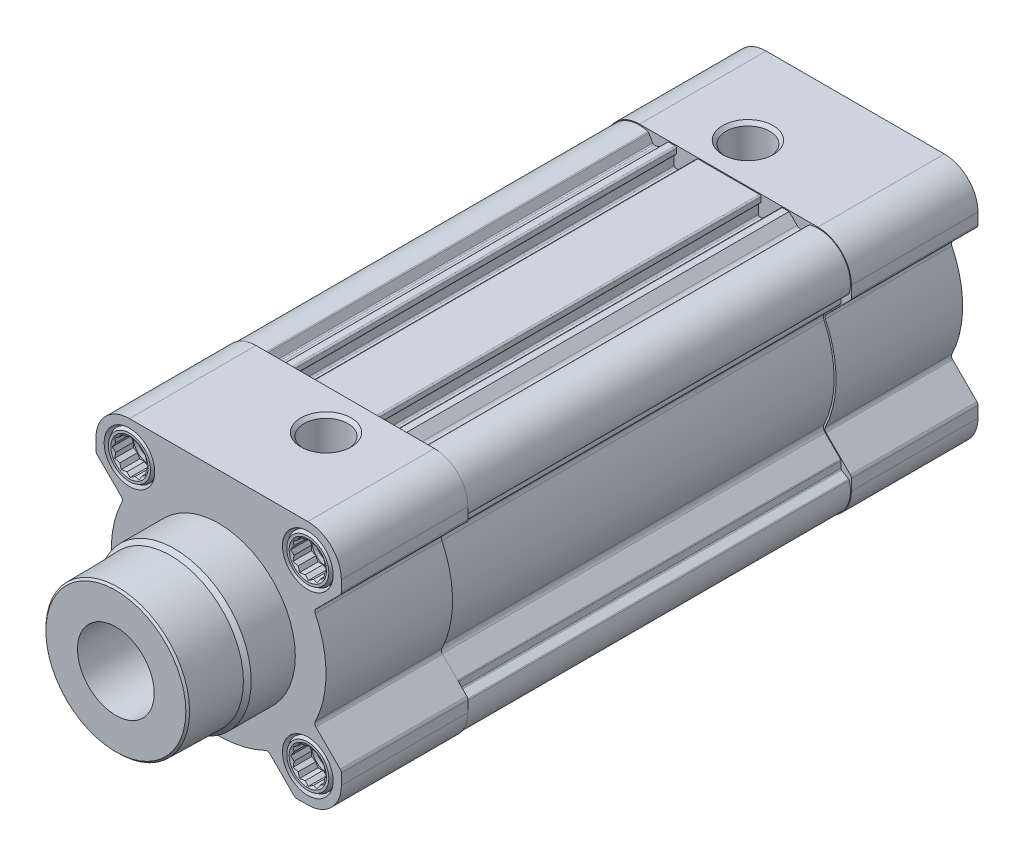
from build123d import *

# Parameters (mm, degrees)
BOSS_EXTRUDE1_DEPTH  = 33
BOSS_EXTRUDE2_DEPTH  = 100
SKETCH3_W            = 76.8
SKETCH3_H            = 76.8
CUT_EXTRUDE1_DEPTH   = 100
BOSS_EXTRUDE3_DEPTH  = 33
HOLE1_D              = 11.445
HOLE1_DEPTH          = 32
HOLE1_CSINK_D        = 13.157
HOLE1_CSINK_ANGLE    = 90
SKETCH8_W            = 24.5
SKETCH8_H            = 6.6
LPATTERN1_COUNT      = 2
LPATTERN1_PITCH      = 46.5
LPATTERN1_COUNT_DIR2 = 2
LPATTERN1_PITCH_DIR2 = 46.5
LPATTERN2_COUNT      = 2
LPATTERN2_PITCH      = 46.5
LPATTERN2_COUNT_DIR2 = 2
LPATTERN2_PITCH_DIR2 = 46.5
CUT_EXTRUDE2_DEPTH   = 5
LPATTERN3_COUNT      = 2
LPATTERN3_PITCH      = 46.5
LPATTERN3_COUNT_DIR2 = 2
LPATTERN3_PITCH_DIR2 = 46.5
LPATTERN4_COUNT      = 2
LPATTERN4_PITCH      = 46.5
LPATTERN4_COUNT_DIR2 = 2
LPATTERN4_PITCH_DIR2 = 46.5
HOLE2_D              = 11.445
HOLE2_DEPTH          = 32
HOLE2_CSINK_D        = 13.157
HOLE2_CSINK_ANGLE    = 90
HOLE3_D              = 13.2
HOLE3_DEPTH          = 24.5
LPATTERN5_COUNT      = 2
LPATTERN5_PITCH      = 46.5
LPATTERN5_COUNT_DIR2 = 2
LPATTERN5_PITCH_DIR2 = 46.5
LPATTERN6_COUNT      = 2
LPATTERN6_PITCH      = 46.5
LPATTERN6_COUNT_DIR2 = 2
LPATTERN6_PITCH_DIR2 = 46.5
LPATTERN7_COUNT      = 2
LPATTERN7_PITCH      = 46.5
LPATTERN7_COUNT_DIR2 = 2
LPATTERN7_PITCH_DIR2 = 46.5
CUT_EXTRUDE3_DEPTH   = 5
LPATTERN8_COUNT      = 2
LPATTERN8_PITCH      = 46.5
LPATTERN8_COUNT_DIR2 = 2
LPATTERN8_PITCH_DIR2 = 46.5


with BuildPart() as part:
    # Sketch1 → Boss-Extrude1 (new body)
    with BuildSketch(Plane.XY.offset(-33)):
        with BuildLine():
            Line((-31.707106781, 19.686291501), (-25.38500441, 13.36418913))
            ThreePointArc((-25.38500441, 13.36418913), (-25.10600235, 12.82318278), (-25.192383219, 12.220631233))
            ThreePointArc((-25.192383219, 12.220631233), (-28, 0), (-25.192383219, -12.220631233))
            ThreePointArc((-25.192383219, -12.220631233), (-25.10600235, -12.82318278), (-25.38500441, -13.36418913))
            Line((-25.38500441, -13.36418913), (-31.707106781, -19.686291501))
            ThreePointArc((-31.707106781, -19.686291501), (-31.923879533, -20.01071485), (-32, -20.393398282))
            Line((-32, -20.393398282), (-32, -23.25))
            ThreePointArc((-32, -23.25), (-29.437184335, -29.437184335), (-23.25, -32))
            Line((-23.25, -32), (-20.393398282, -32))
            ThreePointArc((-20.393398282, -32), (-20.01071485, -31.923879533), (-19.686291501, -31.707106781))
            Line((-19.686291501, -31.707106781), (-13.36418913, -25.38500441))
            ThreePointArc((-13.36418913, -25.38500441), (-12.82318278, -25.10600235), (-12.220631233, -25.192383219))
            ThreePointArc((-12.220631233, -25.192383219), (0, -28), (12.220631233, -25.192383219))
            ThreePointArc((12.220631233, -25.192383219), (12.82318278, -25.10600235), (13.36418913, -25.38500441))
            Line((13.36418913, -25.38500441), (19.686291501, -31.707106781))
            ThreePointArc((19.686291501, -31.707106781), (20.01071485, -31.923879533), (20.393398282, -32))
            Line((20.393398282, -32), (23.25, -32))
            ThreePointArc((23.25, -32), (29.437184335, -29.437184335), (32, -23.25))
            Line((32, -23.25), (32, -20.393398282))
            ThreePointArc((32, -20.393398282), (31.923879533, -20.01071485), (31.707106781, -19.686291501))
            Line((31.707106781, -19.686291501), (25.38500441, -13.36418913))
            ThreePointArc((25.38500441, -13.36418913), (25.10600235, -12.82318278), (25.192383219, -12.220631233))
            ThreePointArc((25.192383219, -12.220631233), (28, 0), (25.192383219, 12.220631233))
            ThreePointArc((25.192383219, 12.220631233), (25.10600235, 12.82318278), (25.38500441, 13.36418913))
            Line((25.38500441, 13.36418913), (31.707106781, 19.686291501))
            ThreePointArc((31.707106781, 19.686291501), (31.923879533, 20.01071485), (32, 20.393398282))
            Line((32, 20.393398282), (32, 23.25))
            ThreePointArc((32, 23.25), (29.437184335, 29.437184335), (23.25, 32))
            Line((23.25, 32), (-23.25, 32))
            ThreePointArc((-23.25, 32), (-29.437184335, 29.437184335), (-32, 23.25))
            Line((-32, 23.25), (-32, 20.393398282))
            ThreePointArc((-32, 20.393398282), (-31.923879533, 20.01071485), (-31.707106781, 19.686291501))
        make_face()
    extrude(amount=BOSS_EXTRUDE1_DEPTH)

    # Sketch2 → Boss-Extrude2 (add)
    with BuildSketch(Plane.XY.offset(-33)):
        with BuildLine():
            Line((-31.75, 20.08273811), (-25.296126931, 13.628865041))
            ThreePointArc((-25.296126931, 13.628865041), (-24.87846612, 12.822305384), (-25.00284256, 11.922577907))
            ThreePointArc((-25.00284256, 11.922577907), (-27.7, 0), (-25.00284256, -11.922577907))
            ThreePointArc((-25.00284256, -11.922577907), (-24.87846612, -12.822305384), (-25.296126931, -13.628865041))
            Line((-25.296126931, -13.628865041), (-31.75, -20.08273811))
            Line((-31.75, -20.08273811), (-31.75, -23.5))
            ThreePointArc((-31.75, -23.5), (-29.333630945, -29.333630945), (-23.5, -31.75))
            Line((-23.5, -31.75), (-20.08273811, -31.75))
            Line((-20.08273811, -31.75), (-13.628865041, -25.296126931))
            ThreePointArc((-13.628865041, -25.296126931), (-12.822305384, -24.87846612), (-11.922577907, -25.00284256))
            ThreePointArc((-11.922577907, -25.00284256), (0, -27.7), (11.922577907, -25.00284256))
            ThreePointArc((11.922577907, -25.00284256), (12.822305384, -24.87846612), (13.628865041, -25.296126931))
            Line((13.628865041, -25.296126931), (20.08273811, -31.75))
            Line((20.08273811, -31.75), (23.5, -31.75))
            ThreePointArc((23.5, -31.75), (29.333630945, -29.333630945), (31.75, -23.5))
            Line((31.75, -23.5), (31.75, -20.08273811))
            Line((31.75, -20.08273811), (25.296126931, -13.628865041))
            ThreePointArc((25.296126931, -13.628865041), (24.87846612, -12.822305384), (25.00284256, -11.922577907))
            ThreePointArc((25.00284256, -11.922577907), (27.7, 0), (25.00284256, 11.922577907))
            ThreePointArc((25.00284256, 11.922577907), (24.87846612, 12.822305384), (25.296126931, 13.628865041))
            Line((25.296126931, 13.628865041), (31.75, 20.08273811))
            Line((31.75, 20.08273811), (31.75, 23.5))
            ThreePointArc((31.75, 23.5), (29.333630945, 29.333630945), (23.5, 31.75))
            Line((23.5, 31.75), (-23.5, 31.75))
            ThreePointArc((-23.5, 31.75), (-29.333630945, 29.333630945), (-31.75, 23.5))
            Line((-31.75, 23.5), (-31.75, 20.08273811))
        make_face()
    extrude(amount=-BOSS_EXTRUDE2_DEPTH)

    # Sketch3 → Cut-Extrude1 (cut)
    with BuildSketch(Plane.XY.offset(-33)):
        Rectangle(SKETCH3_W, SKETCH3_H)
        with BuildLine():
            Line((-20.847700821, -31.237836974), (-19.815492663, -29.45))
            ThreePointArc((-19.815492663, -29.45), (-19.669082502, -29.303589838), (-19.469082502, -29.25))
            Line((-19.469082502, -29.25), (-17.748423535, -29.25))
            ThreePointArc((-17.748423535, -29.25), (-17.595350162, -29.219551813), (-17.465580823, -29.132842712))
            Line((-17.465580823, -29.132842712), (-13.478767922, -25.146029812))
            ThreePointArc((-13.478767922, -25.146029812), (-12.674014627, -24.728680623), (-11.775791832, -24.851171536))
            ThreePointArc((-11.775791832, -24.851171536), (0, -27.5), (11.775791832, -24.851171536))
            ThreePointArc((11.775791832, -24.851171536), (12.674014627, -24.728680623), (13.478767922, -25.146029812))
            Line((13.478767922, -25.146029812), (17.465580823, -29.132842712))
            ThreePointArc((17.465580823, -29.132842712), (17.595350162, -29.219551813), (17.748423535, -29.25))
            Line((17.748423535, -29.25), (19.469082502, -29.25))
            ThreePointArc((19.469082502, -29.25), (19.669082502, -29.303589838), (19.815492663, -29.45))
            Line((19.815492663, -29.45), (20.847700821, -31.237836974))
            ThreePointArc((20.847700821, -31.237836974), (20.947545902, -31.352806276), (21.083122856, -31.422130658))
            ThreePointArc((21.083122856, -31.422130658), (29.304341623, -29.304341623), (31.422130658, -21.083122856))
            ThreePointArc((31.422130658, -21.083122856), (31.352806276, -20.947545902), (31.237836974, -20.847700821))
            Line((31.237836974, -20.847700821), (29.45, -19.815492663))
            ThreePointArc((29.45, -19.815492663), (29.303589838, -19.669082502), (29.25, -19.469082502))
            Line((29.25, -19.469082502), (29.25, -17.748423535))
            ThreePointArc((29.25, -17.748423535), (29.219551813, -17.595350162), (29.132842712, -17.465580823))
            Line((29.132842712, -17.465580823), (25.146029812, -13.478767922))
            ThreePointArc((25.146029812, -13.478767922), (24.728680623, -12.674014627), (24.851171536, -11.775791832))
            ThreePointArc((24.851171536, -11.775791832), (27.5, 0), (24.851171536, 11.775791832))
            ThreePointArc((24.851171536, 11.775791832), (24.728680623, 12.674014627), (25.146029812, 13.478767922))
            Line((25.146029812, 13.478767922), (29.132842712, 17.465580823))
            ThreePointArc((29.132842712, 17.465580823), (29.219551813, 17.595350162), (29.25, 17.748423535))
            Line((29.25, 17.748423535), (29.25, 19.469082502))
            ThreePointArc((29.25, 19.469082502), (29.303589838, 19.669082502), (29.45, 19.815492663))
            Line((29.45, 19.815492663), (31.237836974, 20.847700821))
            ThreePointArc((31.237836974, 20.847700821), (31.352806276, 20.947545902), (31.422130658, 21.083122856))
            ThreePointArc((31.422130658, 21.083122856), (29.304341623, 29.304341623), (21.083122856, 31.422130658))
            ThreePointArc((21.083122856, 31.422130658), (20.947545902, 31.352806276), (20.847700821, 31.237836974))
            Line((20.847700821, 31.237836974), (19.815492663, 29.45))
            ThreePointArc((19.815492663, 29.45), (19.669082502, 29.303589838), (19.469082502, 29.25))
            Line((19.469082502, 29.25), (18.871320344, 29.25))
            ThreePointArc((18.871320344, 29.25), (18.297295195, 29.364180701), (17.810660172, 29.689339828))
            Line((17.810660172, 29.689339828), (15.75, 31.75))
            Line((15.75, 31.75), (14, 31.75))
            ThreePointArc((14, 31.75), (13.717157288, 31.632842712), (13.6, 31.35))
            Line((13.6, 31.35), (13.6, 30.15))
            ThreePointArc((13.6, 30.15), (13.658578644, 30.008578644), (13.8, 29.95))
            Line((13.8, 29.95), (14.05, 29.95))
            ThreePointArc((14.05, 29.95), (14.191421356, 29.891421356), (14.25, 29.75))
            Line((14.25, 29.75), (14.25, 27.15))
            ThreePointArc((14.25, 27.15), (14.132842712, 26.867157288), (13.85, 26.75))
            Line((13.85, 26.75), (8.15, 26.75))
            ThreePointArc((8.15, 26.75), (7.867157288, 26.867157288), (7.75, 27.15))
            Line((7.75, 27.15), (7.75, 29.75))
            ThreePointArc((7.75, 29.75), (7.808578644, 29.891421356), (7.95, 29.95))
            Line((7.95, 29.95), (8.2, 29.95))
            ThreePointArc((8.2, 29.95), (8.341421356, 30.008578644), (8.4, 30.15))
            Line((8.4, 30.15), (8.4, 31.35))
            ThreePointArc((8.4, 31.35), (8.282842712, 31.632842712), (8, 31.75))
            Line((8, 31.75), (-8, 31.75))
            ThreePointArc((-8, 31.75), (-8.282842712, 31.632842712), (-8.4, 31.35))
            Line((-8.4, 31.35), (-8.4, 30.15))
            ThreePointArc((-8.4, 30.15), (-8.341421356, 30.008578644), (-8.2, 29.95))
            Line((-8.2, 29.95), (-7.95, 29.95))
            ThreePointArc((-7.95, 29.95), (-7.808578644, 29.891421356), (-7.75, 29.75))
            Line((-7.75, 29.75), (-7.75, 27.15))
            ThreePointArc((-7.75, 27.15), (-7.867157288, 26.867157288), (-8.15, 26.75))
            Line((-8.15, 26.75), (-13.85, 26.75))
            ThreePointArc((-13.85, 26.75), (-14.132842712, 26.867157288), (-14.25, 27.15))
            Line((-14.25, 27.15), (-14.25, 29.75))
            ThreePointArc((-14.25, 29.75), (-14.191421356, 29.891421356), (-14.05, 29.95))
            Line((-14.05, 29.95), (-13.8, 29.95))
            ThreePointArc((-13.8, 29.95), (-13.658578644, 30.008578644), (-13.6, 30.15))
            Line((-13.6, 30.15), (-13.6, 31.35))
            ThreePointArc((-13.6, 31.35), (-13.717157288, 31.632842712), (-14, 31.75))
            Line((-14, 31.75), (-15.75, 31.75))
            Line((-15.75, 31.75), (-17.810660172, 29.689339828))
            ThreePointArc((-17.810660172, 29.689339828), (-18.297295195, 29.364180701), (-18.871320344, 29.25))
            Line((-18.871320344, 29.25), (-19.469082502, 29.25))
            ThreePointArc((-19.469082502, 29.25), (-19.669082502, 29.303589838), (-19.815492663, 29.45))
            Line((-19.815492663, 29.45), (-20.847700821, 31.237836974))
            ThreePointArc((-20.847700821, 31.237836974), (-20.947545902, 31.352806276), (-21.083122856, 31.422130658))
            ThreePointArc((-21.083122856, 31.422130658), (-29.304341623, 29.304341623), (-31.422130658, 21.083122856))
            ThreePointArc((-31.422130658, 21.083122856), (-31.352806276, 20.947545902), (-31.237836974, 20.847700821))
            Line((-31.237836974, 20.847700821), (-29.45, 19.815492663))
            ThreePointArc((-29.45, 19.815492663), (-29.303589838, 19.669082502), (-29.25, 19.469082502))
            Line((-29.25, 19.469082502), (-29.25, 17.748423535))
            ThreePointArc((-29.25, 17.748423535), (-29.219551813, 17.595350162), (-29.132842712, 17.465580823))
            Line((-29.132842712, 17.465580823), (-25.146029812, 13.478767922))
            ThreePointArc((-25.146029812, 13.478767922), (-24.728680623, 12.674014627), (-24.851171536, 11.775791832))
            ThreePointArc((-24.851171536, 11.775791832), (-27.5, 0), (-24.851171536, -11.775791832))
            ThreePointArc((-24.851171536, -11.775791832), (-24.728680623, -12.674014627), (-25.146029812, -13.478767922))
            Line((-25.146029812, -13.478767922), (-29.132842712, -17.465580823))
            ThreePointArc((-29.132842712, -17.465580823), (-29.219551813, -17.595350162), (-29.25, -17.748423535))
            Line((-29.25, -17.748423535), (-29.25, -19.469082502))
            ThreePointArc((-29.25, -19.469082502), (-29.303589838, -19.669082502), (-29.45, -19.815492663))
            Line((-29.45, -19.815492663), (-31.237836974, -20.847700821))
            ThreePointArc((-31.237836974, -20.847700821), (-31.352806276, -20.947545902), (-31.422130658, -21.083122856))
            ThreePointArc((-31.422130658, -21.083122856), (-29.304341623, -29.304341623), (-21.083122856, -31.422130658))
            ThreePointArc((-21.083122856, -31.422130658), (-20.947545902, -31.352806276), (-20.847700821, -31.237836974))
        make_face(mode=Mode.SUBTRACT)
    extrude(amount=-CUT_EXTRUDE1_DEPTH, mode=Mode.SUBTRACT)

    # Sketch4 → Boss-Extrude3 (add)
    with BuildSketch(Plane.XY.offset(-166)):
        with BuildLine():
            Line((-31.707106781, 19.686291501), (-25.38500441, 13.36418913))
            ThreePointArc((-25.38500441, 13.36418913), (-25.10600235, 12.82318278), (-25.192383219, 12.220631233))
            ThreePointArc((-25.192383219, 12.220631233), (-28, 0), (-25.192383219, -12.220631233))
            ThreePointArc((-25.192383219, -12.220631233), (-25.10600235, -12.82318278), (-25.38500441, -13.36418913))
            Line((-25.38500441, -13.36418913), (-31.707106781, -19.686291501))
            ThreePointArc((-31.707106781, -19.686291501), (-31.923879533, -20.01071485), (-32, -20.393398282))
            Line((-32, -20.393398282), (-32, -23.25))
            ThreePointArc((-32, -23.25), (-29.437184335, -29.437184335), (-23.25, -32))
            Line((-23.25, -32), (-20.393398282, -32))
            ThreePointArc((-20.393398282, -32), (-20.01071485, -31.923879533), (-19.686291501, -31.707106781))
            Line((-19.686291501, -31.707106781), (-13.36418913, -25.38500441))
            ThreePointArc((-13.36418913, -25.38500441), (-12.82318278, -25.10600235), (-12.220631233, -25.192383219))
            ThreePointArc((-12.220631233, -25.192383219), (0, -28), (12.220631233, -25.192383219))
            ThreePointArc((12.220631233, -25.192383219), (12.82318278, -25.10600235), (13.36418913, -25.38500441))
            Line((13.36418913, -25.38500441), (19.686291501, -31.707106781))
            ThreePointArc((19.686291501, -31.707106781), (20.01071485, -31.923879533), (20.393398282, -32))
            Line((20.393398282, -32), (23.25, -32))
            ThreePointArc((23.25, -32), (29.437184335, -29.437184335), (32, -23.25))
            Line((32, -23.25), (32, -20.393398282))
            ThreePointArc((32, -20.393398282), (31.923879533, -20.01071485), (31.707106781, -19.686291501))
            Line((31.707106781, -19.686291501), (25.38500441, -13.36418913))
            ThreePointArc((25.38500441, -13.36418913), (25.10600235, -12.82318278), (25.192383219, -12.220631233))
            ThreePointArc((25.192383219, -12.220631233), (28, 0), (25.192383219, 12.220631233))
            ThreePointArc((25.192383219, 12.220631233), (25.10600235, 12.82318278), (25.38500441, 13.36418913))
            Line((25.38500441, 13.36418913), (31.707106781, 19.686291501))
            ThreePointArc((31.707106781, 19.686291501), (31.923879533, 20.01071485), (32, 20.393398282))
            Line((32, 20.393398282), (32, 23.25))
            ThreePointArc((32, 23.25), (29.437184335, 29.437184335), (23.25, 32))
            Line((23.25, 32), (-23.25, 32))
            ThreePointArc((-23.25, 32), (-29.437184335, 29.437184335), (-32, 23.25))
            Line((-32, 23.25), (-32, 20.393398282))
            ThreePointArc((-32, 20.393398282), (-31.923879533, 20.01071485), (-31.707106781, 19.686291501))
        make_face()
    extrude(amount=BOSS_EXTRUDE3_DEPTH)

    # Sketch5 → Revolve1 (revolve)
    with BuildSketch(Plane(origin=(0, 0, 0), x_dir=(0, 0, -1), z_dir=(1, 0, 0))):
        Polygon((-26.8, 0), (-26.8, 18.241665039), (-26.3, 18.741665039), (-12.517765157, 18.982234843), (-11.5, 20), (0, 20), (0, 0), align=None)
    revolve(axis=Axis((0, 0, 0), (0, 0, 1)))

    # Hole1
    with Locations(Plane(origin=(0, 32, 0), x_dir=(1, 0, 0), z_dir=(0, 1, 0))):
        with Locations((5.5, 22.5)):
            CounterSinkHole(HOLE1_D / 2, HOLE1_CSINK_D / 2, depth=HOLE1_DEPTH, counter_sink_angle=HOLE1_CSINK_ANGLE)

    # Sketch8 → Cut-Revolve1 (revolve, cut)
    with BuildSketch(Plane(origin=(23.25, 0, 0), x_dir=(0, 0, -1), z_dir=(1, 0, 0))):
        with Locations((12.25, 26.55)):
            Rectangle(SKETCH8_W, SKETCH8_H)
    cut_revolve1 = revolve(axis=Axis((23.25, 23.25, -24.5), (0, 0, 1)), mode=Mode.SUBTRACT)

    # LPattern1: Cut-Revolve1 2 × 2
    with Locations(*[(-i * LPATTERN1_PITCH, -j * LPATTERN1_PITCH_DIR2, 0) for i in range(LPATTERN1_COUNT) for j in range(LPATTERN1_COUNT_DIR2) if (i, j) != (0, 0)]):
        add(cut_revolve1, mode=Mode.SUBTRACT)

    # Sketch10 → Revolve2 (revolve)
    with BuildSketch(Plane(origin=(23.25, 0, 0), x_dir=(0, 0, -1), z_dir=(1, 0, 0))):
        Polygon((0, 23.25), (0, 28.730384758), (0.9, 29.25), (24.5, 29.25), (24.5, 23.25), align=None)
    revolve2 = revolve(axis=Axis((23.25, 23.25, -24.5), (0, 0, 1)))

    # LPattern2: Revolve2 2 × 2
    with Locations(*[(-i * LPATTERN2_PITCH, -j * LPATTERN2_PITCH_DIR2, 0) for i in range(LPATTERN2_COUNT) for j in range(LPATTERN2_COUNT_DIR2) if (i, j) != (0, 0)]):
        add(revolve2)

    # Sketch12 → Cut-Revolve2 (revolve, cut)
    with BuildSketch(Plane(origin=(23.25, 0, 0), x_dir=(0, 0, -1), z_dir=(1, 0, 0))):
        Polygon((0, 23.25), (0, 28.1), (0.490747729, 27.25), (6, 27.25), (6.6765, 26.5735), (20.2, 26.5735), (22.11882362, 23.25), align=None)
    cut_revolve2 = revolve(axis=Axis((23.25, 23.25, -22.11882362), (0, 0, 1)), mode=Mode.SUBTRACT)

    # Sketch13 → Cut-Extrude2 (cut, symmetric)
    with BuildSketch(Plane.XY):
        Polygon((18.631197846, 23.25), (19.25, 22.17820323), (19.25, 20.940598923), (20.32179677, 20.32179677), (20.940598923, 19.25), (22.17820323, 19.25), (23.25, 18.631197846), (24.32179677, 19.25), (25.559401077, 19.25), (26.17820323, 20.32179677), (27.25, 20.940598923), (27.25, 22.17820323), (27.868802154, 23.25), (27.25, 24.32179677), (27.25, 25.559401077), (26.17820323, 26.17820323), (25.559401077, 27.25), (24.32179677, 27.25), (23.25, 27.868802154), (22.17820323, 27.25), (20.940598923, 27.25), (20.32179677, 26.17820323), (19.25, 25.559401077), (19.25, 24.32179677), align=None)
    cut_extrude2 = extrude(amount=CUT_EXTRUDE2_DEPTH, both=True, mode=Mode.SUBTRACT)

    # LPattern3: Cut-Revolve2 2 × 2
    with Locations(*[(-i * LPATTERN3_PITCH, -j * LPATTERN3_PITCH_DIR2, 0) for i in range(LPATTERN3_COUNT) for j in range(LPATTERN3_COUNT_DIR2) if (i, j) != (0, 0)]):
        add(cut_revolve2, mode=Mode.SUBTRACT)

    # LPattern4: Cut-Extrude2 2 × 2
    with Locations(*[(-i * LPATTERN4_PITCH, -j * LPATTERN4_PITCH_DIR2, 0) for i in range(LPATTERN4_COUNT) for j in range(LPATTERN4_COUNT_DIR2) if (i, j) != (0, 0)]):
        add(cut_extrude2, mode=Mode.SUBTRACT)

    # Sketch16 → Revolve3 (revolve)
    with BuildSketch(Plane(origin=(0, 0, 0), x_dir=(0, 0, -1), z_dir=(1, 0, 0))):
        Polygon((166, 0), (166, 20), (169.5, 20), (170, 19.5), (170, 0), align=None)
    revolve(axis=Axis((0, 0, -170), (0, 0, 1)))

    # Hole2
    with Locations(Plane(origin=(0, 32, 0), x_dir=(1, 0, 0), z_dir=(0, 1, 0))):
        with Locations((-5.5, 143.5)):
            CounterSinkHole(HOLE2_D / 2, HOLE2_CSINK_D / 2, depth=HOLE2_DEPTH, counter_sink_angle=HOLE2_CSINK_ANGLE)

    # Hole3
    with Locations(Plane(origin=(0, 0, -166), x_dir=(-1, 0, 0), z_dir=(0, 0, -1))):
        with Locations((-23.25, 23.25)):
            hole3 = Hole(HOLE3_D / 2, depth=HOLE3_DEPTH)

    # LPattern5: Hole3 2 × 2
    with Locations(*[(-i * LPATTERN5_PITCH, -j * LPATTERN5_PITCH_DIR2, 0) for i in range(LPATTERN5_COUNT) for j in range(LPATTERN5_COUNT_DIR2) if (i, j) != (0, 0)]):
        add(hole3, mode=Mode.SUBTRACT)

    # Sketch22 → Revolve4 (revolve)
    with BuildSketch(Plane(origin=(23.25, 0, 0), x_dir=(0, 0, -1), z_dir=(1, 0, 0))):
        Polygon((141.5, 23.25), (141.5, 29.25), (165.1, 29.25), (166, 28.730384758), (166, 23.25), align=None)
    revolve4 = revolve(axis=Axis((23.25, 23.25, -166), (0, 0, 1)))

    # LPattern6: Revolve4 2 × 2
    with Locations(*[(-i * LPATTERN6_PITCH, -j * LPATTERN6_PITCH_DIR2, 0) for i in range(LPATTERN6_COUNT) for j in range(LPATTERN6_COUNT_DIR2) if (i, j) != (0, 0)]):
        add(revolve4)

    # Sketch24 → Cut-Revolve3 (revolve, cut)
    with BuildSketch(Plane(origin=(23.25, 0, 0), x_dir=(0, 0, -1), z_dir=(1, 0, 0))):
        Polygon((143.88117638, 23.25), (145.8, 26.5735), (159.3235, 26.5735), (160, 27.25), (165.509252271, 27.25), (166, 28.1), (166, 23.25), align=None)
    cut_revolve3 = revolve(axis=Axis((23.25, 23.25, -166), (0, 0, 1)), mode=Mode.SUBTRACT)

    # LPattern7: Cut-Revolve3 2 × 2
    with Locations(*[(-i * LPATTERN7_PITCH, -j * LPATTERN7_PITCH_DIR2, 0) for i in range(LPATTERN7_COUNT) for j in range(LPATTERN7_COUNT_DIR2) if (i, j) != (0, 0)]):
        add(cut_revolve3, mode=Mode.SUBTRACT)

    # Sketch26 → Cut-Extrude3 (cut, symmetric)
    with BuildSketch(Plane.XY.offset(-166)):
        Polygon((18.631197846, 23.25), (19.25, 22.17820323), (19.25, 20.940598923), (20.32179677, 20.32179677), (20.940598923, 19.25), (22.17820323, 19.25), (23.25, 18.631197846), (24.32179677, 19.25), (25.559401077, 19.25), (26.17820323, 20.32179677), (27.25, 20.940598923), (27.25, 22.17820323), (27.868802154, 23.25), (27.25, 24.32179677), (27.25, 25.559401077), (26.17820323, 26.17820323), (25.559401077, 27.25), (24.32179677, 27.25), (23.25, 27.868802154), (22.17820323, 27.25), (20.940598923, 27.25), (20.32179677, 26.17820323), (19.25, 25.559401077), (19.25, 24.32179677), align=None)
    cut_extrude3 = extrude(amount=CUT_EXTRUDE3_DEPTH, both=True, mode=Mode.SUBTRACT)

    # LPattern8: Cut-Extrude3 2 × 2
    with Locations(*[(-i * LPATTERN8_PITCH, -j * LPATTERN8_PITCH_DIR2, 0) for i in range(LPATTERN8_COUNT) for j in range(LPATTERN8_COUNT_DIR2) if (i, j) != (0, 0)]):
        add(cut_extrude3, mode=Mode.SUBTRACT)

    # Sketch28 → Cut-Revolve4 (revolve, cut)
    with BuildSketch(Plane(origin=(0, 0, 0), x_dir=(0, 0, -1), z_dir=(1, 0, 0))):
        Polygon((-26.8, 0), (-26.8, 10), (56.333333333, 10), (56.333333333, 25), (133, 25), (133, 0), align=None)
    revolve(axis=Axis((0, 0, -133), (0, 0, 1)), mode=Mode.SUBTRACT)


solid = part.part
